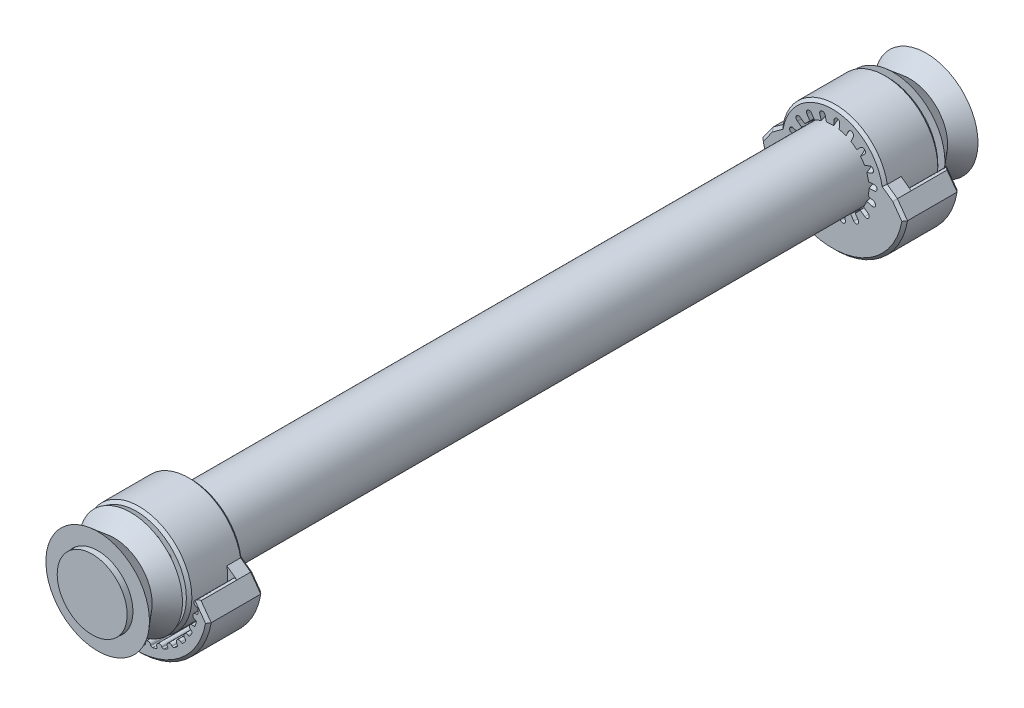
from build123d import *

# Parameters (mm, degrees)
SKETCH1_R              = 6.35
BOSS_EXTRUDE1_DEPTH    = 152.4
BOSS_EXTRUDE5_START    = -8
SKETCH5_R              = 9.6
SKETCH5_R_2            = 6.6
BOSS_EXTRUDE5_DEPTH    = 10
BOSS_EXTRUDE5_2_DEPTH  = 10
SKETCH6_R              = 6.6
BOSS_EXTRUDE6_DEPTH    = 3
CUT_SWEEP1_PITCH       = 100
CUT_SWEEP1_HEIGHT      = 10
CUT_SWEEP1_RADIUS      = 6.6
CUT_SWEEP1_START_ANGLE = 180
CIRPATTERN1_COUNT      = 18
CHAMFER4_SIZE          = 0.5


with BuildPart() as part:
    # Sketch1 → Boss-Extrude1 (new body)
    with BuildSketch(Plane.XY):
        with Locations(Location((0, 0, 0), (0, 0, 180))):
            Circle(SKETCH1_R)
    extrude(amount=BOSS_EXTRUDE1_DEPTH)


with BuildPart() as body_2:
    # Sketch5 → Boss-Extrude5 (new body)
    with BuildSketch(Plane.XY.offset(152.4).offset(BOSS_EXTRUDE5_START)):
        Circle(SKETCH5_R)
        Circle(SKETCH5_R_2, mode=Mode.SUBTRACT)
    extrude(amount=-BOSS_EXTRUDE5_DEPTH)



with BuildPart() as body_3:
    # Sketch5 → Boss-Extrude5 2 (new body)
    with BuildSketch(Plane.XY.offset(152.4).offset(BOSS_EXTRUDE5_START)):
        with BuildLine():
            Line((-11.272714026, 0.405362183), (-13.106099458, -2.142091736))
            ThreePointArc((-13.106099458, -2.142091736), (0, -13.28), (13.106099458, -2.142091736))
            Line((13.106099458, -2.142091736), (11.272714026, 0.405362183))
            ThreePointArc((11.272714026, 0.405362183), (10.502099071, 0.147005789), (10.994280804, -0.499796017))
            ThreePointArc((10.994280804, -0.499796017), (11.183768836, -0.57732033), (11.253706219, -0.769737834))
            ThreePointArc((11.253706219, -0.769737834), (11.225683717, -1.105633343), (11.187637812, -1.440541633))
            ThreePointArc((11.187637812, -1.440541633), (11.081505463, -1.615617782), (10.880534147, -1.654685206))
            ThreePointArc((10.880534147, -1.654685206), (10.278629739, -2.044546575), (10.685523416, -2.635070359))
            ThreePointArc((10.685523416, -2.635070359), (10.856246245, -2.748072346), (10.887301008, -2.950436708))
            ThreePointArc((10.887301008, -2.950436708), (10.794286987, -3.274411159), (10.691634757, -3.595461892))
            ThreePointArc((10.691634757, -3.595461892), (10.55338605, -3.746468608), (10.348654665, -3.745577804))
            ThreePointArc((10.348654665, -3.745577804), (9.682257501, -4.010522371), (9.966127355, -4.669080425))
            ThreePointArc((9.966127355, -4.669080425), (10.111524198, -4.813217482), (10.102502924, -5.017751953))
            ThreePointArc((10.102502924, -5.017751953), (9.948071862, -5.317355191), (9.784758175, -5.612210568))
            ThreePointArc((9.784758175, -5.612210568), (9.619705929, -5.733344747), (9.419082188, -5.692529948))
            ThreePointArc((9.419082188, -5.692529948), (8.713801537, -5.822376042), (8.863738608, -6.523660349))
            ThreePointArc((8.863738608, -6.523660349), (8.978221948, -6.69339337), (8.929471319, -6.892237805))
            ThreePointArc((8.929471319, -6.892237805), (8.719557914, -7.155956245), (8.501858823, -7.413285139))
            ThreePointArc((8.501858823, -7.413285139), (8.316345904, -7.499891663), (8.127539664, -7.420721358))
            ThreePointArc((8.127539664, -7.420721358), (7.410479067, -7.410479067), (7.420721358, -8.127539664))
            ThreePointArc((7.420721358, -8.127539664), (7.499891663, -8.316345904), (7.413285139, -8.501858823))
            ThreePointArc((7.413285139, -8.501858823), (7.155956245, -8.719557914), (6.892237805, -8.929471319))
            ThreePointArc((6.892237805, -8.929471319), (6.69339337, -8.978221948), (6.523660349, -8.863738608))
            ThreePointArc((6.523660349, -8.863738608), (5.822376042, -8.713801537), (5.692529948, -9.419082188))
            ThreePointArc((5.692529948, -9.419082188), (5.733344747, -9.619705929), (5.612210568, -9.784758175))
            ThreePointArc((5.612210568, -9.784758175), (5.317355191, -9.948071862), (5.017751953, -10.102502924))
            ThreePointArc((5.017751953, -10.102502924), (4.813217482, -10.111524198), (4.669080425, -9.966127355))
            ThreePointArc((4.669080425, -9.966127355), (4.010522371, -9.682257501), (3.745577804, -10.348654665))
            ThreePointArc((3.745577804, -10.348654665), (3.746468608, -10.55338605), (3.595461892, -10.691634757))
            ThreePointArc((3.595461892, -10.691634757), (3.274411159, -10.794286987), (2.950436708, -10.887301008))
            ThreePointArc((2.950436708, -10.887301008), (2.748072346, -10.856246245), (2.635070359, -10.685523416))
            ThreePointArc((2.635070359, -10.685523416), (2.044546575, -10.278629739), (1.654685206, -10.880534147))
            ThreePointArc((1.654685206, -10.880534147), (1.615617782, -11.081505463), (1.440541633, -11.187637812))
            ThreePointArc((1.440541633, -11.187637812), (1.105633343, -11.225683717), (0.769737834, -11.253706219))
            ThreePointArc((0.769737834, -11.253706219), (0.57732033, -11.183768836), (0.499796017, -10.994280804))
            ThreePointArc((0.499796017, -10.994280804), (0, -10.48), (-0.499796017, -10.994280804))
            ThreePointArc((-0.499796017, -10.994280804), (-0.57732033, -11.183768836), (-0.769737834, -11.253706219))
            ThreePointArc((-0.769737834, -11.253706219), (-1.105633343, -11.225683717), (-1.440541633, -11.187637812))
            ThreePointArc((-1.440541633, -11.187637812), (-1.615617782, -11.081505463), (-1.654685206, -10.880534147))
            ThreePointArc((-1.654685206, -10.880534147), (-2.044546575, -10.278629739), (-2.635070359, -10.685523416))
            ThreePointArc((-2.635070359, -10.685523416), (-2.748072346, -10.856246245), (-2.950436708, -10.887301008))
            ThreePointArc((-2.950436708, -10.887301008), (-3.274411159, -10.794286987), (-3.595461892, -10.691634757))
            ThreePointArc((-3.595461892, -10.691634757), (-3.746468608, -10.55338605), (-3.745577804, -10.348654665))
            ThreePointArc((-3.745577804, -10.348654665), (-4.010522371, -9.682257501), (-4.669080425, -9.966127355))
            ThreePointArc((-4.669080425, -9.966127355), (-4.813217482, -10.111524198), (-5.017751953, -10.102502924))
            ThreePointArc((-5.017751953, -10.102502924), (-5.317355191, -9.948071862), (-5.612210568, -9.784758175))
            ThreePointArc((-5.612210568, -9.784758175), (-5.733344747, -9.619705929), (-5.692529948, -9.419082188))
            ThreePointArc((-5.692529948, -9.419082188), (-5.822376042, -8.713801537), (-6.523660349, -8.863738608))
            ThreePointArc((-6.523660349, -8.863738608), (-6.69339337, -8.978221948), (-6.892237805, -8.929471319))
            ThreePointArc((-6.892237805, -8.929471319), (-7.155956245, -8.719557914), (-7.413285139, -8.501858823))
            ThreePointArc((-7.413285139, -8.501858823), (-7.499891663, -8.316345904), (-7.420721358, -8.127539664))
            ThreePointArc((-7.420721358, -8.127539664), (-7.410479067, -7.410479067), (-8.127539664, -7.420721358))
            ThreePointArc((-8.127539664, -7.420721358), (-8.316345904, -7.499891663), (-8.501858823, -7.413285139))
            ThreePointArc((-8.501858823, -7.413285139), (-8.719557914, -7.155956245), (-8.929471319, -6.892237805))
            ThreePointArc((-8.929471319, -6.892237805), (-8.978221948, -6.69339337), (-8.863738608, -6.523660349))
            ThreePointArc((-8.863738608, -6.523660349), (-8.713801537, -5.822376042), (-9.419082188, -5.692529948))
            ThreePointArc((-9.419082188, -5.692529948), (-9.619705929, -5.733344747), (-9.784758175, -5.612210568))
            ThreePointArc((-9.784758175, -5.612210568), (-9.948071862, -5.317355191), (-10.102502924, -5.017751953))
            ThreePointArc((-10.102502924, -5.017751953), (-10.111524198, -4.813217482), (-9.966127355, -4.669080425))
            ThreePointArc((-9.966127355, -4.669080425), (-9.682257501, -4.010522371), (-10.348654665, -3.745577804))
            ThreePointArc((-10.348654665, -3.745577804), (-10.55338605, -3.746468608), (-10.691634757, -3.595461892))
            ThreePointArc((-10.691634757, -3.595461892), (-10.794286987, -3.274411159), (-10.887301008, -2.950436708))
            ThreePointArc((-10.887301008, -2.950436708), (-10.856246245, -2.748072346), (-10.685523416, -2.635070359))
            ThreePointArc((-10.685523416, -2.635070359), (-10.278629739, -2.044546575), (-10.880534147, -1.654685206))
            ThreePointArc((-10.880534147, -1.654685206), (-11.081505463, -1.615617782), (-11.187637812, -1.440541633))
            ThreePointArc((-11.187637812, -1.440541633), (-11.225683717, -1.105633343), (-11.253706219, -0.769737834))
            ThreePointArc((-11.253706219, -0.769737834), (-11.183768836, -0.57732033), (-10.994280804, -0.499796017))
            ThreePointArc((-10.994280804, -0.499796017), (-10.502099071, 0.147005789), (-11.272714026, 0.405362183))
        make_face()
    extrude(amount=-BOSS_EXTRUDE5_2_DEPTH)


with BuildPart() as body_2_1:
    add(body_2.part)

    add(body_3.part)  # Boss-Extrude6 merges body 3
    # Sketch6 → Boss-Extrude6 (add)
    with BuildSketch(Plane(origin=(0, 0, 134.4), x_dir=(-1, 0, 0), z_dir=(0, 0, -1))):
        with BuildLine():
            Line((-11.272714026, 0.405362183), (-13.106099458, -2.142091736))
            ThreePointArc((-13.106099458, -2.142091736), (0, -13.28), (13.106099458, -2.142091736))
            Line((13.106099458, -2.142091736), (11.272714026, 0.405362183))
            Line((11.272714026, 0.405362183), (9.4435232, 1.726229873))
            ThreePointArc((9.4435232, 1.726229873), (0, 9.6), (-9.4435232, 1.726229873))
            Line((-9.4435232, 1.726229873), (-11.272714026, 0.405362183))
        make_face()
        with Locations(Location((0, 0, 0), (0, 0, 180))):
            Circle(SKETCH6_R, mode=Mode.SUBTRACT)
    extrude(amount=-BOSS_EXTRUDE6_DEPTH)

    # Cut-Sweep1: sweep along a helix
    with BuildLine() as cut_sweep1_path:
        add(Helix(CUT_SWEEP1_PITCH, CUT_SWEEP1_HEIGHT, CUT_SWEEP1_RADIUS, center=(0, 0, 144.4), direction=(0, 0, -1), mode=Mode.PRIVATE).rotate(Axis((0, 0, 144.4), (0, 0, -1)), CUT_SWEEP1_START_ANGLE))
    # Sketch11 → Cut-Sweep1 (sweep, cut)
    with BuildSketch(Plane.XY.offset(144.4)):
        with BuildLine():
            Line((6.6, 0.5), (7.6, 0.5))
            ThreePointArc((7.6, 0.5), (8.1, 0), (7.6, -0.5))
            Line((7.6, -0.5), (6.6, -0.5))
            ThreePointArc((6.6, -0.5), (6.1, 0), (6.6, 0.5))
        make_face()
    cut_sweep1 = sweep(path=cut_sweep1_path.line, is_frenet=True, mode=Mode.SUBTRACT)

    # CirPattern1: Cut-Sweep1 ×18 about axis
    cirpattern1_axis = Axis((0, 0, 152.4), (0, 0, -1))
    for i in range(1, CIRPATTERN1_COUNT):
        add(cut_sweep1.rotate(cirpattern1_axis, i * 360 / CIRPATTERN1_COUNT), mode=Mode.SUBTRACT)

    # Chamfer4
    chamfer4_edges = [body_2_1.edges().sort_by_distance(p)[0] for p in [
        (-12.189406742, -0.868364776, 144.4),
        (0, -13.28, 144.4),
        (12.189406742, -0.868364776, 144.4),
        (-10.358118613, 1.065796028, 134.4),
        (10.358118613, 1.065796028, 134.4),
        (12.189406742, -0.868364776, 134.4),
        (0, -13.28, 134.4),
        (-12.189406742, -0.868364776, 134.4),
        (-9.6, 0, 144.4),
        (0, 9.6, 134.4),
    ]]
    chamfer(chamfer4_edges, length=CHAMFER4_SIZE)


with BuildPart() as body_3_2:
    # Sketch9 → Revolve1 (revolve)
    with BuildSketch(Plane(origin=(0, 0, 0), x_dir=(0, 0, -1), z_dir=(1, 0, 0)), mode=Mode.PRIVATE) as revolve1_sk:
        Polygon((-151.4, 6.4), (-145.4, 6.4), (-145.4, 9.4), (-148.4, 6.882701106), (-151.4, 9.4), align=None)
    revolve(revolve1_sk.sketch.rotate(Axis((0, 0, 152.4), (0, 0, -1)), 90), axis=Axis((0, 0, 152.4), (0, 0, -1)))


with BuildPart() as body_4:
    # Mirror1: mirrored copy
    add(body_3_2.part.mirror(Plane(origin=(0, 0, 76.2), x_dir=(1, 0, 0), z_dir=(0, 0, -1))))


with BuildPart() as body_5:
    # Mirror1 2: mirrored copy
    add(body_2_1.part.mirror(Plane(origin=(0, 0, 76.2), x_dir=(1, 0, 0), z_dir=(0, 0, -1))))


solid = Compound([part.part, body_2_1.part, body_3_2.part, body_4.part, body_5.part])
